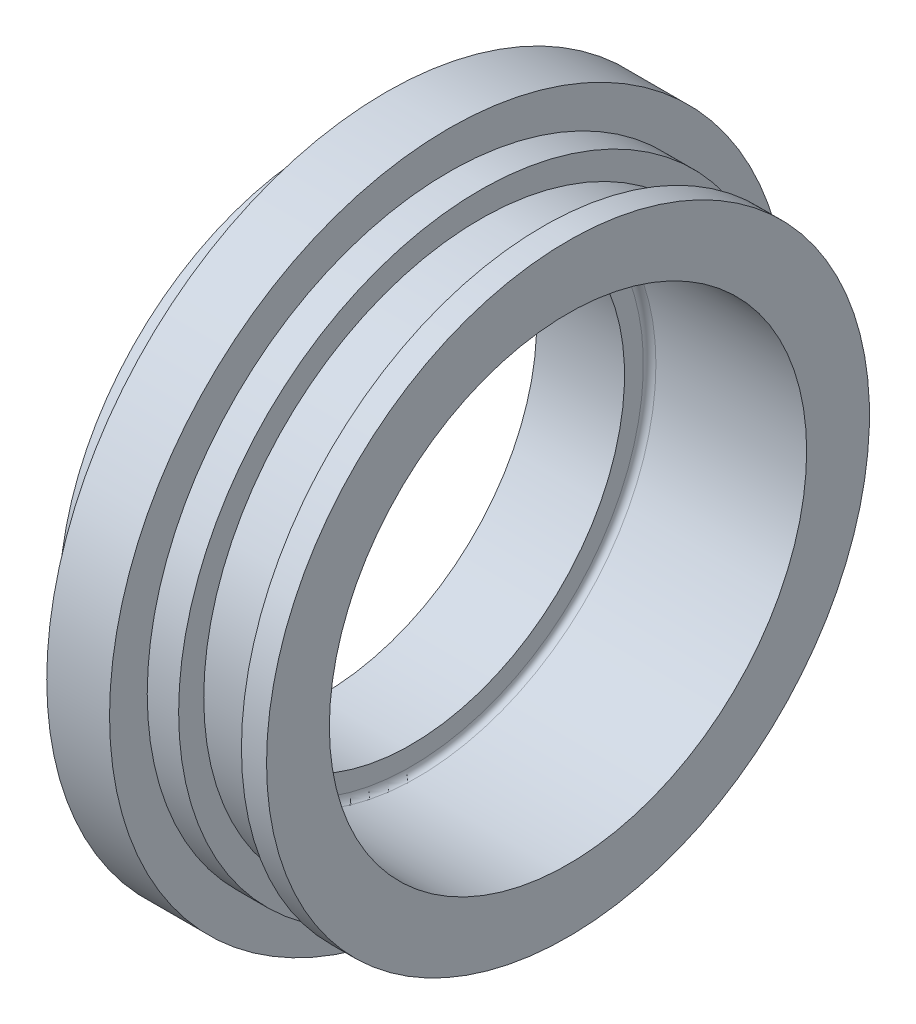
from build123d import *

# Parameters (mm, degrees)
ZAOBLIT1_R = 0.5


with BuildPart() as part:
    # Skica1 → Rotovat1 (revolve)
    with BuildSketch(Plane.XY):
        Polygon((-351.05, 24), (-353.05, 24), (-353.05, 22), (-358.05, 22), (-358.05, 24), (-360.55, 24), (-360.55, 27), (-365.55, 27), (-365.55, 20), (-367.05, 20), (-367.55, 21), (-370.55, 21), (-370.55, 19), (-370.55, 17), (-363.55, 17), (-363.55, 19), (-351.05, 19), align=None)
    revolve(axis=Axis((-379.936676629, 0, 0), (1, 0, 0)))

    # Zaoblit1
    zaoblit1_edges = [part.edges().sort_by_distance(p)[0] for p in [
        (-363.55, -19, 0),
    ]]
    fillet(zaoblit1_edges, radius=ZAOBLIT1_R)


solid = part.part
